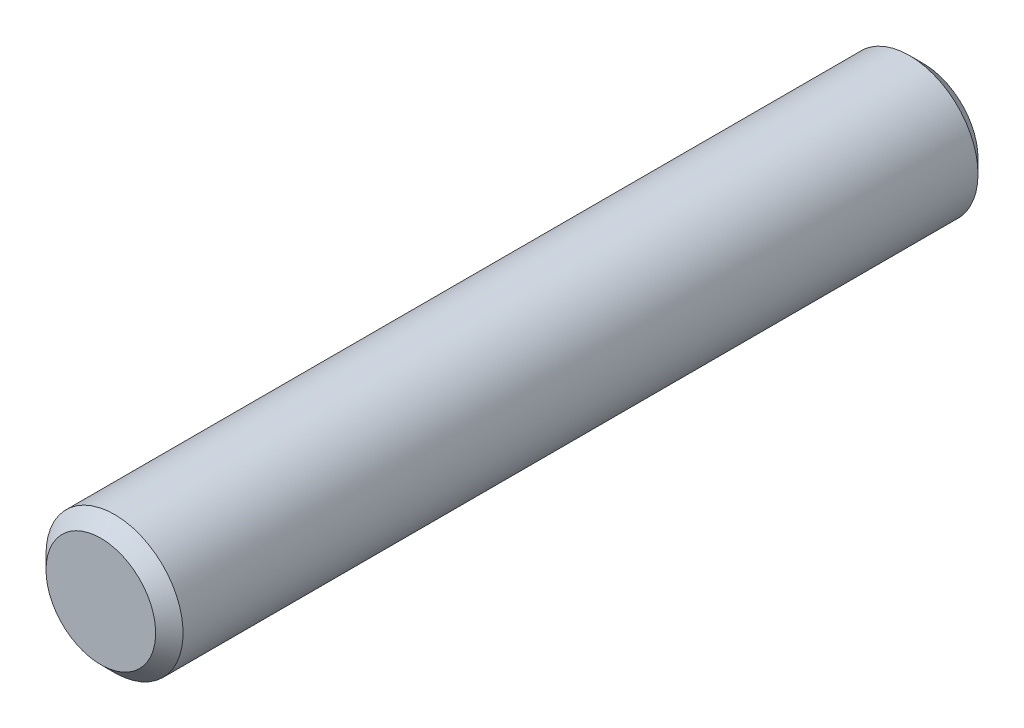
from build123d import *

# Parameters (mm, degrees)
SKETCH1_R      = 3.175
EXTRUDE1_DEPTH = 19.05
CHAMFER1_SIZE  = 0.635


with BuildPart() as part:
    # Sketch1 → Extrude1 (new, symmetric)
    with BuildSketch(Plane.XY):
        Circle(SKETCH1_R)
    extrude(amount=EXTRUDE1_DEPTH, both=True)

    # Chamfer1
    chamfer1_edges = [part.edges().sort_by_distance(p)[0] for p in [
        (-3.175, 0, -19.05),
        (-3.175, 0, 19.05),
    ]]
    chamfer(chamfer1_edges, length=CHAMFER1_SIZE)


solid = part.part
